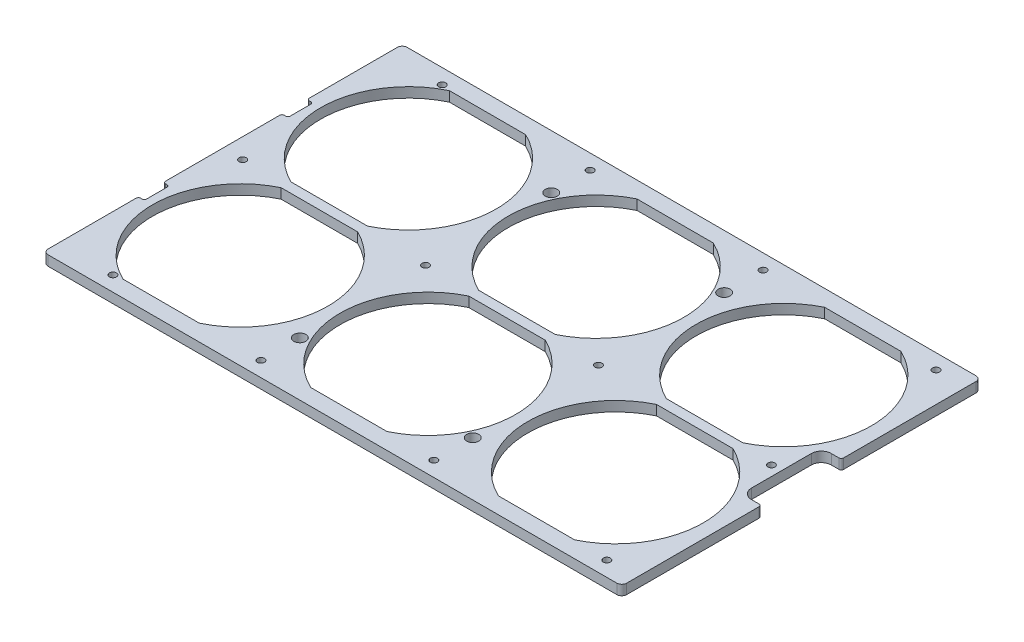
from build123d import *

# Parameters (mm, degrees)
SKETCH1_R               = 2.2479
SKETCH1_R_2             = 3.81
BOSS_EXTRUDE1_DEPTH     = 6.35
CUT_EXTRUDE1_DEPTH      = 217.831812703
CUT_EXTRUDE1_DEPTH_BACK = 217.831812703
SKETCH3_W               = 3.81
SKETCH3_H               = 15.875
CUT_EXTRUDE2_DEPTH      = 217.831812703
FILLET1_R               = 1.524


with BuildPart() as part:
    # Sketch1 → Boss-Extrude1 (new body)
    with BuildSketch(Plane(origin=(0, 0, 0), x_dir=(1, 0, 0), z_dir=(0, 1, 0))):
        with BuildLine():
            Line((-180.975, 114.3), (180.975, 114.3))
            ThreePointArc((180.975, 114.3), (183.22006403, 113.37006403), (184.15, 111.125))
            Line((184.15, 111.125), (184.15, -111.125))
            ThreePointArc((184.15, -111.125), (183.22006403, -113.37006403), (180.975, -114.3))
            Line((180.975, -114.3), (-180.975, -114.3))
            ThreePointArc((-180.975, -114.3), (-183.22006403, -113.37006403), (-184.15, -111.125))
            Line((-184.15, -111.125), (-184.15, 111.125))
            ThreePointArc((-184.15, 111.125), (-183.22006403, 113.37006403), (-180.975, 114.3))
        make_face()
        with Locations((-149.225, -104.775)):
            Circle(SKETCH1_R, mode=Mode.SUBTRACT)
        with Locations((-55.033333333, -104.775)):
            Circle(SKETCH1_R, mode=Mode.SUBTRACT)
        with Locations((55.033333333, -104.775)):
            Circle(SKETCH1_R, mode=Mode.SUBTRACT)
        with Locations((165.1, -104.775)):
            Circle(SKETCH1_R, mode=Mode.SUBTRACT)
        with Locations((165.1, 104.775)):
            Circle(SKETCH1_R, mode=Mode.SUBTRACT)
        with Locations((55.033333333, 104.775)):
            Circle(SKETCH1_R, mode=Mode.SUBTRACT)
        with Locations((-55.033333333, 104.775)):
            Circle(SKETCH1_R, mode=Mode.SUBTRACT)
        with Locations((-149.225, 104.775)):
            Circle(SKETCH1_R, mode=Mode.SUBTRACT)
        with Locations((-55.033333333, 0)):
            Circle(SKETCH1_R, mode=Mode.SUBTRACT)
        with Locations((55.033333333, 0)):
            Circle(SKETCH1_R, mode=Mode.SUBTRACT)
        with Locations((-55.0291, 80.01)):
            Circle(SKETCH1_R_2, mode=Mode.SUBTRACT)
        with Locations((-55.0291, -80.01)):
            Circle(SKETCH1_R_2, mode=Mode.SUBTRACT)
        with Locations((55.0291, -80.01)):
            Circle(SKETCH1_R_2, mode=Mode.SUBTRACT)
        with Locations((55.0291, 80.01)):
            Circle(SKETCH1_R_2, mode=Mode.SUBTRACT)
        with Locations((165.1, 0)):
            Circle(SKETCH1_R, mode=Mode.SUBTRACT)
        with Locations((-171.45, 0)):
            Circle(SKETCH1_R, mode=Mode.SUBTRACT)
        with BuildLine():
            Line((-24.3078, -3.1623), (24.3078, -3.1623))
            ThreePointArc((24.3078, -3.1623), (55.879209158, -53.5178), (24.3078, -103.8733))
            Line((24.3078, -103.8733), (-24.3078, -103.8733))
            ThreePointArc((-24.3078, -103.8733), (-55.879209158, -53.5178), (-24.3078, -3.1623))
        make_face(mode=Mode.SUBTRACT)
        with BuildLine():
            Line((95.136490842, -3.1623), (143.752090842, -3.1623))
            ThreePointArc((143.752090842, -3.1623), (175.3235, -53.5178), (143.752090842, -103.8733))
            Line((143.752090842, -103.8733), (95.136490842, -103.8733))
            ThreePointArc((95.136490842, -103.8733), (63.565081684, -53.5178), (95.136490842, -3.1623))
        make_face(mode=Mode.SUBTRACT)
        with BuildLine():
            Line((-143.752090842, -3.1623), (-95.136490842, -3.1623))
            ThreePointArc((-95.136490842, -3.1623), (-63.565081684, -53.5178), (-95.136490842, -103.8733))
            Line((-95.136490842, -103.8733), (-143.752090842, -103.8733))
            ThreePointArc((-143.752090842, -103.8733), (-175.3235, -53.5178), (-143.752090842, -3.1623))
        make_face(mode=Mode.SUBTRACT)
        with BuildLine():
            Line((-24.3078, 103.8733), (24.3078, 103.8733))
            ThreePointArc((24.3078, 103.8733), (55.879209158, 53.5178), (24.3078, 3.1623))
            Line((24.3078, 3.1623), (-24.3078, 3.1623))
            ThreePointArc((-24.3078, 3.1623), (-55.879209158, 53.5178), (-24.3078, 103.8733))
        make_face(mode=Mode.SUBTRACT)
        with BuildLine():
            Line((-143.752090842, 103.8733), (-95.136490842, 103.8733))
            ThreePointArc((-95.136490842, 103.8733), (-63.565081684, 53.5178), (-95.136490842, 3.1623))
            Line((-95.136490842, 3.1623), (-143.752090842, 3.1623))
            ThreePointArc((-143.752090842, 3.1623), (-175.3235, 53.5178), (-143.752090842, 103.8733))
        make_face(mode=Mode.SUBTRACT)
        with BuildLine():
            Line((95.136490842, 103.8733), (143.752090842, 103.8733))
            ThreePointArc((143.752090842, 103.8733), (175.3235, 53.5178), (143.752090842, 3.1623))
            Line((143.752090842, 3.1623), (95.136490842, 3.1623))
            ThreePointArc((95.136490842, 3.1623), (63.565081684, 53.5178), (95.136490842, 103.8733))
        make_face(mode=Mode.SUBTRACT)
    extrude(amount=BOSS_EXTRUDE1_DEPTH)

    # Sketch2 → Cut-Extrude1 (cut, two sides: drawn at the far end of the back side and taken through both)
    with BuildSketch(Plane(origin=(0, 6.35, 0), x_dir=(1, 0, 0), z_dir=(0, 1, 0)).offset(-CUT_EXTRUDE1_DEPTH_BACK)):
        with BuildLine():
            Line((184.15, 25.4), (177.8, 25.4))
            ThreePointArc((177.8, 25.4), (173.309871939, 23.540128061), (171.45, 19.05))
            Line((171.45, 19.05), (171.45, -19.05))
            ThreePointArc((171.45, -19.05), (173.309871939, -23.540128061), (177.8, -25.4))
            Line((177.8, -25.4), (184.15, -25.4))
            Line((184.15, -25.4), (184.15, 25.4))
        make_face()
    extrude(amount=CUT_EXTRUDE1_DEPTH + CUT_EXTRUDE1_DEPTH_BACK, mode=Mode.SUBTRACT)

    # Sketch3 → Cut-Extrude2 (cut, through all)
    with BuildSketch(Plane(origin=(0, 6.35, 0), x_dir=(1, 0, 0), z_dir=(0, 1, 0))):
        with Locations((-182.245, 45.72)):
            Rectangle(SKETCH3_W, SKETCH3_H)
        with Locations((-182.245, -45.72)):
            Rectangle(SKETCH3_W, SKETCH3_H)
    extrude(amount=-CUT_EXTRUDE2_DEPTH, mode=Mode.SUBTRACT)

    # Fillet1
    fillet1_edges = [part.edges().sort_by_distance(p)[0] for p in [
        (184.15, 3.175, 25.4),
        (184.15, 3.175, -25.4),
        (-180.34, 3.175, 37.7825),
        (-184.15, 3.175, 37.7825),
        (-184.15, 3.175, 53.6575),
        (-180.34, 3.175, 53.6575),
        (-184.15, 3.175, -37.7825),
        (-180.34, 3.175, -37.7825),
        (-184.15, 3.175, -53.6575),
        (-180.34, 3.175, -53.6575),
    ]]
    fillet(fillet1_edges, radius=FILLET1_R)


solid = part.part
